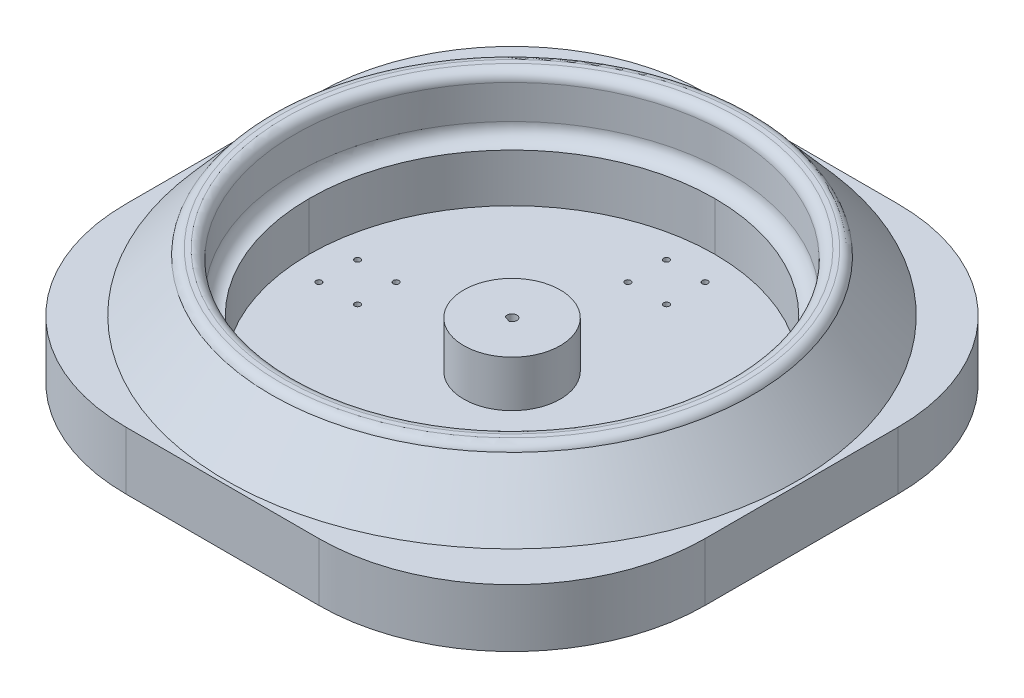
from build123d import *

# Parameters (mm, degrees)
SKETCH1_W           = 300
SKETCH1_H           = 300
BOSS_EXTRUDE1_DEPTH = 30
SKETCH2_W           = 210
SKETCH2_H           = 210
CUT_EXTRUDE1_DEPTH  = 25
SKETCH6_R           = 25
BOSS_EXTRUDE3_DEPTH = 24
SKETCH4_R           = 1.5
CUT_EXTRUDE3_DEPTH  = 5
CUT_EXTRUDE4_DEPTH  = 15
FILLET1_R           = 105
SKETCH5_R           = 125
SKETCH5_R_2         = 112.5
BOSS_EXTRUDE2_DEPTH = 30
FILLET5_R           = 7.5
FILLET6_R           = 5
FILLET7_R           = 100


with BuildPart() as part:
    # Sketch1 → Boss-Extrude1 (new body)
    with BuildSketch(Plane(origin=(0, 0, 0), x_dir=(1, 0, 0), z_dir=(0, 1, 0))):
        Rectangle(SKETCH1_W, SKETCH1_H)
    extrude(amount=BOSS_EXTRUDE1_DEPTH)

    # Sketch2 → Cut-Extrude1 (cut)
    with BuildSketch(Plane(origin=(0, 30, 0), x_dir=(1, 0, 0), z_dir=(0, 1, 0))):
        Rectangle(SKETCH2_W, SKETCH2_H)
    extrude(amount=-CUT_EXTRUDE1_DEPTH, mode=Mode.SUBTRACT)

    # Sketch6 → Boss-Extrude3 (add)
    with BuildSketch(Plane(origin=(0, 5, 0), x_dir=(1, 0, 0), z_dir=(0, 1, 0))):
        with Locations(Location((0, 0, 0), (0, 0, 270))):
            Circle(SKETCH6_R)
    extrude(amount=BOSS_EXTRUDE3_DEPTH)

    # Sketch4 → Cut-Extrude3 (cut)
    with BuildSketch(Plane(origin=(0, 5, 0), x_dir=(1, 0, 0), z_dir=(0, 1, 0))):
        with Locations(Location((90, 10, 0), (0, 0, 270))):
            Circle(SKETCH4_R)
        with Locations(Location((90, -10, 0), (0, 0, 90))):
            Circle(SKETCH4_R)
        with Locations(Location((70, -10, 0), (0, 0, 270))):
            Circle(SKETCH4_R)
        with Locations(Location((70, 10, 0), (0, 0, 90))):
            Circle(SKETCH4_R)
        with Locations(Location((-90, -10, 0), (0, 0, 270))):
            Circle(SKETCH4_R)
        with Locations(Location((-70, -10, 0), (0, 0, 90))):
            Circle(SKETCH4_R)
        with Locations(Location((-70, 10, 0), (0, 0, 270))):
            Circle(SKETCH4_R)
        with Locations(Location((-90, 10, 0), (0, 0, 90))):
            Circle(SKETCH4_R)
        with Locations(Location((10, -70, 0), (0, 0, 90))):
            Circle(SKETCH4_R)
        with Locations(Location((10, -90, 0), (0, 0, 270))):
            Circle(SKETCH4_R)
        with Locations(Location((-10, -90, 0), (0, 0, 90))):
            Circle(SKETCH4_R)
        with Locations(Location((-10, -70, 0), (0, 0, 270))):
            Circle(SKETCH4_R)
        with Locations(Location((10, 70, 0), (0, 0, 270))):
            Circle(SKETCH4_R)
        with Locations(Location((10, 90, 0), (0, 0, 90))):
            Circle(SKETCH4_R)
        with Locations(Location((-10, 70, 0), (0, 0, 90))):
            Circle(SKETCH4_R)
        with Locations(Location((-10, 90, 0), (0, 0, 270))):
            Circle(SKETCH4_R)
    extrude(amount=-CUT_EXTRUDE3_DEPTH, mode=Mode.SUBTRACT)

    # Sketch7 → Cut-Extrude4 (cut)
    with BuildSketch(Plane(origin=(0, 29, 0), x_dir=(1, 0, 0), z_dir=(0, 1, 0))):
        with BuildLine():
            Line((-2.100270755, -1.356046738), (0.899729245, -2.332485217))
            ThreePointArc((0.899729245, -2.332485217), (2.061470726, -1.414333215), (2.5, 0))
            ThreePointArc((2.5, 0), (-0.706867425, 2.397986331), (-2.100270755, -1.356046738))
        make_face()
    extrude(amount=-CUT_EXTRUDE4_DEPTH, mode=Mode.SUBTRACT)

    # Fillet1
    fillet1_edges = [part.edges().sort_by_distance(p)[0] for p in [
        (-105, 17.5, 105),
        (105, 17.5, 105),
        (105, 17.5, -105),
        (-105, 17.5, -105),
    ]]
    fillet(fillet1_edges, radius=FILLET1_R - 0.0001)  # a hair under: the kernel refuses the full size

    # Sketch5 → Boss-Extrude2 (add)
    with BuildSketch(Plane(origin=(0, 30, 0), x_dir=(1, 0, 0), z_dir=(0, 1, 0))):
        with Locations(Location((0, 0, 0), (0, 0, 90))):
            Circle(SKETCH5_R)
        with Locations(Location((0, 0, 0), (0, 0, 270))):
            Circle(SKETCH5_R_2, mode=Mode.SUBTRACT)
    extrude(amount=BOSS_EXTRUDE2_DEPTH)

    # Fillet5
    fillet5_edges = [part.edges().sort_by_distance(p)[0] for p in [
        (0, 30, -112.5),
    ]]
    fillet(fillet5_edges, radius=FILLET5_R - 0.0001)  # a hair under: the kernel refuses the full size

    # Fillet6
    fillet6_edges = [part.edges().sort_by_distance(p)[0] for p in [
        (0, 60, 125),
        (0, 60, -112.5),
    ]]
    fillet(fillet6_edges, radius=FILLET6_R)

    # Chamfer1: read off the stored shape, not the designer's step
    # Chamfer1 outline → Chamfer1 (revolve)
    with BuildSketch(Plane.XY):
        Polygon((124.670923067, 56.783950028), (124.670923067, 55), (125, 55), (125, 30), (148.025538402, 30), align=None)
    revolve(axis=Axis((0, 0, 0), (0, 1, 0)))

    # Fillet7
    fillet7_edges = [part.edges().sort_by_distance(p)[0] for p in [
        (150, 15, 150),
        (-150, 15, 150),
        (-150, 15, -150),
        (150, 15, -150),
    ]]
    fillet(fillet7_edges, radius=FILLET7_R)


solid = part.part
